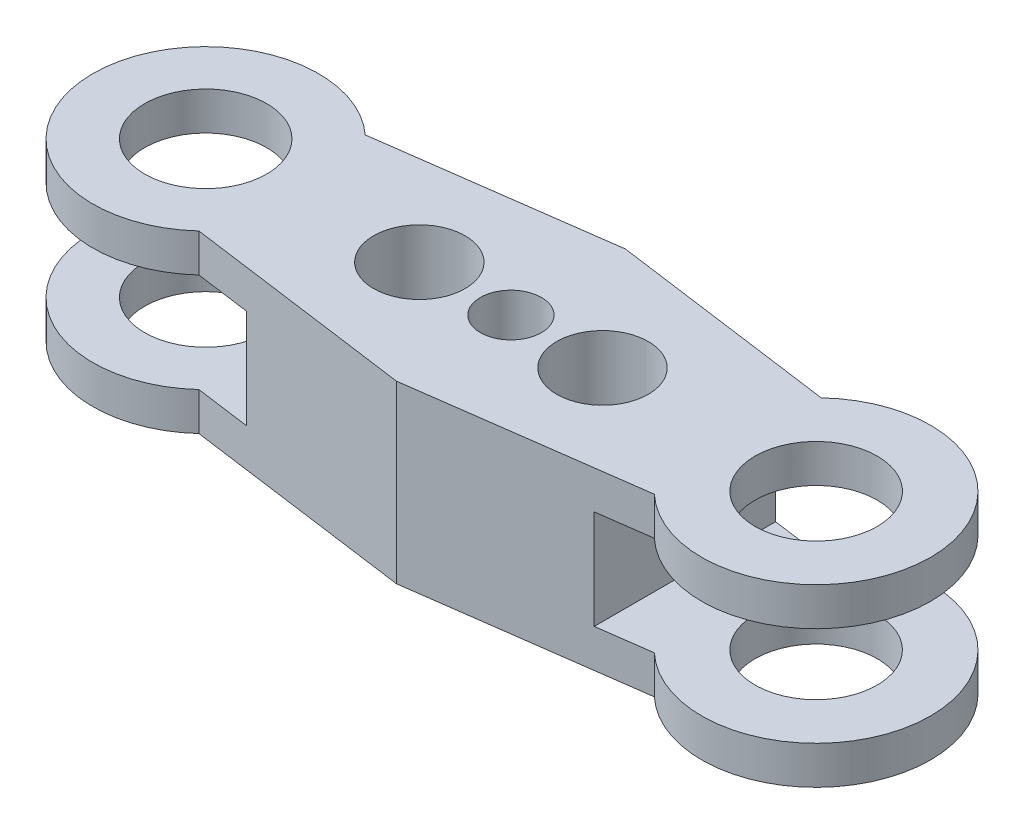
from build123d import *

# Parameters (mm, degrees)
IZIM2_R                     = 4
IZIM2_R_2                   = 3
IZIM2_R_3                   = 2
Y_KSEKLIK_EKSTR_ZYON1_DEPTH = 11.5
KES_EKSTR_ZYON9_DEPTH       = 50
KES_EKSTR_ZYON9_DEPTH_BACK  = 50
IZIM16_W                    = 17.702500787
IZIM16_H                    = 6.5


with BuildPart() as part:
    # Çizim2 → Yükseklik-Ekstrüzyon1 (new body)
    with BuildSketch(Plane(origin=(0, 0, 0), x_dir=(1, 0, 0), z_dir=(0, 1, 0))):
        with BuildLine():
            Line((0, 7.5), (-14.995122872, 5.45))
            ThreePointArc((-14.995122872, 5.45), (-27.399411806, 0), (-14.995122872, -5.45))
            Line((-14.995122872, -5.45), (0, -7.5))
            Line((0, -7.5), (14.866270364, -5.46761557))
            ThreePointArc((14.866270364, -5.46761557), (27.5, 0), (14.866270364, 5.46761557))
            Line((14.866270364, 5.46761557), (0, 7.5))
        make_face()
        with Locations((-20, 0)):
            Circle(IZIM2_R, mode=Mode.SUBTRACT)
        with Locations((-6, 0)):
            Circle(IZIM2_R_2, mode=Mode.SUBTRACT)
        Circle(IZIM2_R_3, mode=Mode.SUBTRACT)
        with Locations((6, 0)):
            Circle(IZIM2_R_2, mode=Mode.SUBTRACT)
        with Locations((20, 0)):
            Circle(IZIM2_R, mode=Mode.SUBTRACT)
    extrude(amount=Y_KSEKLIK_EKSTR_ZYON1_DEPTH)

    # Çizim16 → Kes-Ekstrüzyon9 (cut, two sides: drawn at the far end of the back side and taken through both)
    with BuildSketch(Plane.XY.offset(-KES_EKSTR_ZYON9_DEPTH_BACK)):
        with Locations((-20.2506622, 5.75)):
            Rectangle(IZIM16_W, IZIM16_H)
        with Locations((20.2506622, 5.75)):
            Rectangle(IZIM16_W, IZIM16_H)
    extrude(amount=KES_EKSTR_ZYON9_DEPTH + KES_EKSTR_ZYON9_DEPTH_BACK, mode=Mode.SUBTRACT)


solid = part.part
